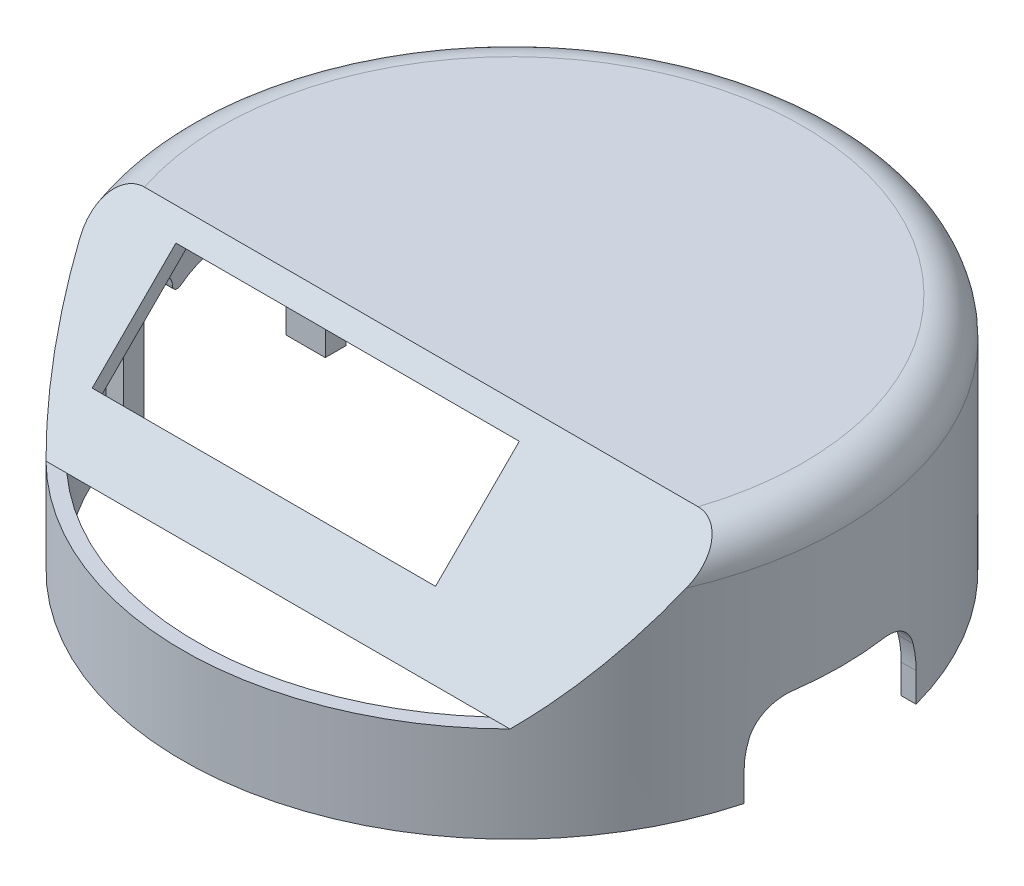
from build123d import *
from build123d.topology import SkipClean

# Parameters (mm, degrees)
SKETCH1_R                = 69
SKETCH1_R_2              = 66
BOSS_EXTRUDE1_DEPTH      = 40
SKETCH4_W                = 30.6
SKETCH4_H                = 30.6
CUT_EXTRUDE2_DEPTH       = 106.460893226
CUT_EXTRUDE6_DEPTH       = 106.460893226
BOSS_EXTRUDE2_REACH      = 165.561
BOSS_EXTRUDE2_START      = -58.1
SKETCH8_W                = 46.6
SKETCH8_H                = 35
BOSS_EXTRUDE4_DEPTH      = 30
SKETCH9_OUTSIDE_W        = 206.013
SKETCH9_OUTSIDE_H        = 183.444
SKETCH9_OUTSIDE_R        = 69
CUT_EXTRUDE7_DEPTH       = 125.513010153
SKETCH14_R               = 69
CUT_EXTRUDE13_DEPTH      = 106.460893226
CUT_EXTRUDE8_DEPTH       = 106.460893226
CUT_EXTRUDE9_DEPTH       = 106.460893226
CUT_EXTRUDE11_DEPTH      = 4
FILLET3_R                = 1
CUT_EXTRUDE12_DEPTH      = 106.460893395
CUT_EXTRUDE14_DEPTH      = 110.644881447
CUT_EXTRUDE14_DEPTH_BACK = 110.644881447
BOSS_EXTRUDE5_DEPTH      = 3
SKETCH17_W               = 71.9
SKETCH17_H               = 24.8
CUT_EXTRUDE15_DEPTH      = 130.087180004


with BuildPart() as part:
    # Sketch1 → Boss-Extrude1 (new body)
    with BuildSketch(Plane(origin=(0, 0, 0), x_dir=(1, 0, 0), z_dir=(0, 1, 0))):
        Circle(SKETCH1_R)
        Circle(SKETCH1_R_2, mode=Mode.SUBTRACT)
    extrude(amount=BOSS_EXTRUDE1_DEPTH)

    # Sketch4 → Cut-Extrude2 (cut, through all)
    with BuildSketch(Plane(origin=(0, 0, 0), x_dir=(0, 0, -1), z_dir=(1, 0, 0))):
        with Locations((38.6, 15.3)):
            Rectangle(SKETCH4_W, SKETCH4_H)
    extrude(amount=-CUT_EXTRUDE2_DEPTH, mode=Mode.SUBTRACT)

    # Sketch5 → Cut-Extrude6 (cut, through all)
    with BuildSketch(Plane(origin=(0, 0, 0), x_dir=(0, 0, -1), z_dir=(1, 0, 0))):
        with BuildLine():
            Line((19, 13), (19, -6))
            Line((19, -6), (-19, -6))
            Line((-19, -6), (-19, 13))
            ThreePointArc((-19, 13), (0, 32), (19, 13))
        make_face()
    extrude(amount=-CUT_EXTRUDE6_DEPTH, mode=Mode.SUBTRACT)

    # Sketch6 → Boss-Extrude2 (add, up to next)
    with BuildSketch(Plane(origin=(0, 0, 0), x_dir=(0, 0, -1), z_dir=(1, 0, 0)).offset(BOSS_EXTRUDE2_START), mode=Mode.PRIVATE) as boss_extrude2_sk1:
        with BuildLine():
            Line((19, 13), (19, 0))
            Line((19, 0), (23.3, 0))
            Line((23.3, 0), (23.3, 13))
            ThreePointArc((23.3, 13), (0, 36.3), (-23.3, 13))
            Line((-23.3, 13), (-23.3, 0))
            Line((-23.3, 0), (-19, 0))
            Line((-19, 0), (-19, 13))
            ThreePointArc((-19, 13), (0, 32), (19, 13))
        make_face()
    boss_extrude2_tool1 = extrude(boss_extrude2_sk1.sketch, amount=-BOSS_EXTRUDE2_REACH, mode=Mode.PRIVATE) - part.part
    add(boss_extrude2_tool1.solids().sort_by_distance((-58.1, 6.5, 22.709301))[0])

    # Sketch8 → Boss-Extrude4 (add)
    with BuildSketch(Plane(origin=(-10.9, -10.9, 0), x_dir=(0, 0, -1), z_dir=(-0.7071067811865512, -0.7071067811865438, 0))):
        with Locations((0, -66.582903987)):
            Rectangle(SKETCH8_W, SKETCH8_H)
    extrude(amount=BOSS_EXTRUDE4_DEPTH)

    # Sketch9 outside → Cut-Extrude7 (cut, through all)
    with BuildSketch(Plane.XZ):
        with Locations((-11.2845, 0)):
            Rectangle(SKETCH9_OUTSIDE_W, SKETCH9_OUTSIDE_H)
        Circle(SKETCH9_OUTSIDE_R, mode=Mode.SUBTRACT)
    extrude(amount=-CUT_EXTRUDE7_DEPTH, mode=Mode.SUBTRACT)

    # Sketch14 → Cut-Extrude13 (cut, through all)
    with BuildSketch(Plane(origin=(0, 40, 0), x_dir=(1, 0, 0), z_dir=(0, 1, 0))):
        Circle(SKETCH14_R)
    extrude(amount=CUT_EXTRUDE13_DEPTH, mode=Mode.SUBTRACT)

    # Sketch9<3> → Cut-Extrude8 (cut, through all)
    with BuildSketch(Plane.XZ):
        with BuildLine():
            Line((-58.1, -19), (-58.1, -23.3))
            Line((-58.1, -23.3), (-61.750384614, -23.3))
            ThreePointArc((-61.750384614, -23.3), (-52.211852364, -40.372298334), (-38.089237325, -53.9))
            ThreePointArc((-38.089237325, -53.9), (63.102674486, 19.340436209), (-61.750384614, 23.3))
            Line((-61.750384614, 23.3), (-58.1, 23.3))
            Line((-58.1, 23.3), (-58.1, 19))
            Line((-58.1, 19), (-58.1, -19))
        make_face()
    extrude(amount=-CUT_EXTRUDE8_DEPTH, mode=Mode.SUBTRACT)

    # Sketch5<2> → Cut-Extrude9 (cut, through all)
    with BuildSketch(Plane(origin=(0, 0, 0), x_dir=(0, 0, -1), z_dir=(1, 0, 0))):
        with BuildLine():
            Line((19, 13), (19, -6))
            Line((19, -6), (-19, -6))
            Line((-19, -6), (-19, 13))
            ThreePointArc((-19, 13), (0, 32), (19, 13))
        make_face()
    extrude(amount=-CUT_EXTRUDE9_DEPTH, mode=Mode.SUBTRACT)

    # Sketch11 → Cut-Extrude11 (cut)
    with BuildSketch(Plane(origin=(-58.1, 0, 0), x_dir=(0, 0, -1), z_dir=(1, 0, 0))):
        with BuildLine():
            Line((-19.000000298, 29.000000238), (-19, 11.000000238))
            Line((-19, 11.000000238), (-13.000000298, 11.000000238))
            Line((-13.000000298, 11.000000238), (-13.000000298, 29.000000238))
            ThreePointArc((-13.000000298, 29.000000238), (-16.000000298, 32.000000238), (-19.000000298, 29.000000238))
        make_face()
        with BuildLine():
            Line((12.999999702, 29.000000238), (12.999999702, 11.000000238))
            Line((12.999999702, 11.000000238), (19, 11.000000238))
            Line((19, 11.000000238), (18.999999702, 29.000000238))
            ThreePointArc((18.999999702, 29.000000238), (15.999999702, 32.000000238), (12.999999702, 29.000000238))
        make_face()
    extrude(amount=-CUT_EXTRUDE11_DEPTH, mode=Mode.SUBTRACT)

    # Fillet3
    fillet3_edges = [part.edges().sort_by_distance(p)[0] for p in [
        (-60.1, 26.85640674, -12.999999702),
        (-60.1, 26.856406181, 13.000000298),
    ]]
    fillet(fillet3_edges, radius=FILLET3_R)

    # Sketch12 → Cut-Extrude12 (cut, through all)
    with BuildSketch(Plane(origin=(0, 0, 0), x_dir=(0, 0, -1), z_dir=(1, 0, 0))):
        with BuildLine():
            Line((-18, -0.9), (18, -0.9))
            Line((18, -0.9), (18, 6.10000124))
            ThreePointArc((18, 6.10000124), (17.791519065, 8.831639827), (17.170905626, 11.50000124))
            ThreePointArc((17.170905626, 11.50000124), (14.272255841, 15.549807439), (9.539392014, 17.10000124))
            Line((9.539392014, 17.10000124), (-9.539392014, 17.10000124))
            ThreePointArc((-9.539392014, 17.10000124), (-14.272255841, 15.549807439), (-17.170905626, 11.50000124))
            ThreePointArc((-17.170905626, 11.50000124), (-17.791519065, 8.831639827), (-18, 6.10000124))
            Line((-18, 6.10000124), (-18, -0.9))
        make_face()
    extrude(amount=CUT_EXTRUDE12_DEPTH, mode=Mode.SUBTRACT)

    # Sketch13 → Revolve2 (revolve)
    with SkipClean():  # the faces are left unmerged after this step: merging them gives an invalid solid
        with BuildSketch(Plane.XY):
            with BuildLine():
                Line((61, 50), (0, 50))
                Line((0, 50), (0, 47))
                Line((0, 47), (61, 47))
                ThreePointArc((61, 47), (64.535533906, 45.535533906), (66, 42))
                Line((66, 42), (66, 40))
                Line((66, 40), (69, 40))
                Line((69, 40), (69, 42))
                ThreePointArc((69, 42), (66.656854249, 47.656854249), (61, 50))
            make_face()
        revolve(axis=Axis((0, 50, 0), (0, -1, 0)))

    # Sketch15 → Cut-Extrude14 (cut, two sides: drawn at the far end of the back side and taken through both)
    with SkipClean():  # the faces are left unmerged after this step: merging them gives an invalid solid
        with BuildSketch(Plane(origin=(0, 0, 0), x_dir=(0, 0, -1), z_dir=(1, 0, 0)).offset(-CUT_EXTRUDE14_DEPTH_BACK)):
            with BuildLine():
                Line((-69, 20), (-49, 20))
                Line((-49, 20), (-19, 50))
                Line((-19, 50), (-61, 50))
                ThreePointArc((-61, 50), (-66.656854249, 47.656854249), (-69, 42))
                Line((-69, 42), (-69, 20))
            make_face()
        extrude(amount=CUT_EXTRUDE14_DEPTH + CUT_EXTRUDE14_DEPTH_BACK, mode=Mode.SUBTRACT)

    # Sketch16 → Boss-Extrude5 (add)
    with SkipClean():  # the faces are left unmerged after this step: merging them gives an invalid solid
        with BuildSketch(Plane(origin=(0, 34.5, 34.5), x_dir=(1, 0, 0), z_dir=(0, 0.7071067811865511, 0.707106781186544))):
            with BuildLine():
                Line((48.579831206, -20.506096654), (-48.579831206, -20.506096654))
                add(Edge.make_bspline(
                    [(-63.498031466, 10.606601718), (-58.198144531, -7.020385924), (-48.579831206, -20.506096654)],
                    knots=[5.114437513, 5.114437513, 5.114437513, 5.502093015, 5.502093015, 5.502093015], degree=2, weights=[1, 0.981274138, 1]))
                add(Edge.make_bspline(
                    [(-57.965506985, 21.920310217), (-58.272301212, 21.920310217), (-58.577582054, 21.897861128), (-59.184815012, 21.803585666), (-59.488046868, 21.730850424), (-60.068793201, 21.538176352), (-60.349017318, 21.418080149), (-60.889036945, 21.130063878), (-61.150847888, 20.960219395), (-61.636327939, 20.584761769), (-61.861816378, 20.37870564), (-62.280957415, 19.932772406), (-62.475907421, 19.690810873), (-63.002810854, 18.933954014), (-63.279185017, 18.389957738), (-63.602540241, 17.525951968), (-63.694326057, 17.23074772), (-63.84609028, 16.638447224), (-63.906688589, 16.339725144), (-64.000354424, 15.737648329), (-64.033406944, 15.43429107), (-64.073843599, 14.823257288), (-64.081143289, 14.514424101), (-64.066705411, 13.595282636), (-64.009551799, 12.989380817), (-63.813779237, 11.789334026), (-63.67500798, 11.195211035), (-63.498031466, 10.606601718)],
                    knots=[0, 0, 0, 0, 0.0625, 0.0625, 0.125, 0.125, 0.1875, 0.1875, 0.25, 0.25, 0.3125, 0.3125, 0.375, 0.375, 0.5, 0.5, 0.5625, 0.5625, 0.625, 0.625, 0.6875, 0.6875, 0.75, 0.75, 0.875, 0.875, 1, 1, 1, 1], degree=3))
                Line((-57.965506985, 21.920310217), (57.965506985, 21.920310217))
                add(Edge.make_bspline(
                    [(63.498031466, 10.606601718), (63.675039116, 11.195314592), (63.814715007, 11.792386393), (64.011652547, 13.004983306), (64.067754715, 13.614842994), (64.085342862, 14.830153808), (64.047408736, 15.437399054), (63.905301673, 16.34751902), (63.843510227, 16.650097153), (63.691019383, 17.242009955), (63.600129812, 17.532863285), (63.386256143, 18.103385911), (63.263300201, 18.383065018), (62.980726548, 18.929647645), (62.821421143, 19.195273667), (62.470649321, 19.697572169), (62.278376361, 19.935962562), (61.856153911, 20.384277184), (61.626632079, 20.593032582), (61.142443767, 20.965917198), (60.886155543, 21.131901299), (60.343602109, 21.420663042), (60.057163487, 21.54268082), (59.478511533, 21.733343799), (59.18335241, 21.803732506), (58.58198369, 21.8972576), (58.273207299, 21.920310217), (57.965506985, 21.920310217)],
                    knots=[0, 0, 0, 0, 0.125, 0.125, 0.25, 0.25, 0.375, 0.375, 0.4375, 0.4375, 0.5, 0.5, 0.5625, 0.5625, 0.625, 0.625, 0.6875, 0.6875, 0.75, 0.75, 0.8125, 0.8125, 0.875, 0.875, 0.9375, 0.9375, 1, 1, 1, 1], degree=3))
                add(Edge.make_bspline(
                    [(48.579831206, -20.506096654), (58.198144531, -7.020385924), (63.498031466, 10.606601718)],
                    knots=[0.781092292, 0.781092292, 0.781092292, 1.168747794, 1.168747794, 1.168747794], degree=2, weights=[1, 0.981274138, 1]))
            make_face()
        extrude(amount=-BOSS_EXTRUDE5_DEPTH)

    # Sketch17 → Cut-Extrude15 (cut, through all)
    with SkipClean():  # the faces are left unmerged after this step: merging them gives an invalid solid
        with BuildSketch(Plane(origin=(0, 34.5, 34.5), x_dir=(1, 0, 0), z_dir=(0, 0.7071067811865511, 0.707106781186544))):
            with Locations((-12, 4.67766953)):
                Rectangle(SKETCH17_W, SKETCH17_H)
        extrude(amount=-CUT_EXTRUDE15_DEPTH, mode=Mode.SUBTRACT)


solid = part.part
